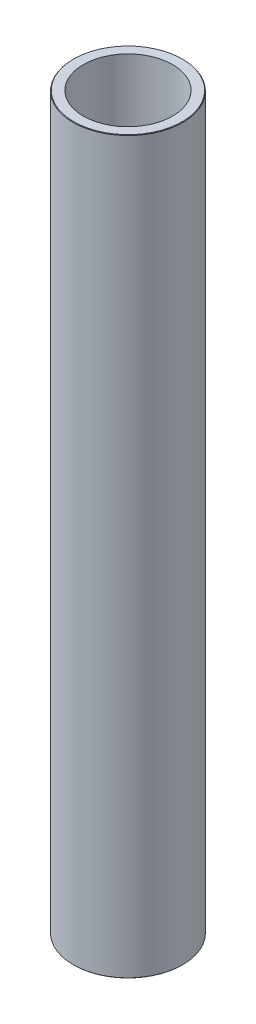
from build123d import *

# Parameters (mm, degrees)
SKETCH1_R           = 45
BOSS_EXTRUDE1_DEPTH = 600
SKETCH2_R           = 36.676349994
CUT_EXTRUDE1_DEPTH  = 604.365560834
CHAMFER1_SIZE       = 0.394463509


with BuildPart() as part:
    # Sketch1 → Boss-Extrude1 (new body)
    with BuildSketch(Plane(origin=(0, 0, 0), x_dir=(1, 0, 0), z_dir=(0, 1, 0))):
        Circle(SKETCH1_R)
    extrude(amount=BOSS_EXTRUDE1_DEPTH)

    # Sketch2 → Cut-Extrude1 (cut, through all)
    with BuildSketch(Plane(origin=(0, 0, 0), x_dir=(1, 0, 0), z_dir=(0, 1, 0))):
        Circle(SKETCH2_R)
    extrude(amount=CUT_EXTRUDE1_DEPTH, mode=Mode.SUBTRACT)

    # Chamfer1
    chamfer1_edges = [part.edges().sort_by_distance(p)[0] for p in [
        (-45, 600, 0),
        (-45, 0, 0),
    ]]
    chamfer(chamfer1_edges, length=CHAMFER1_SIZE)


solid = part.part
